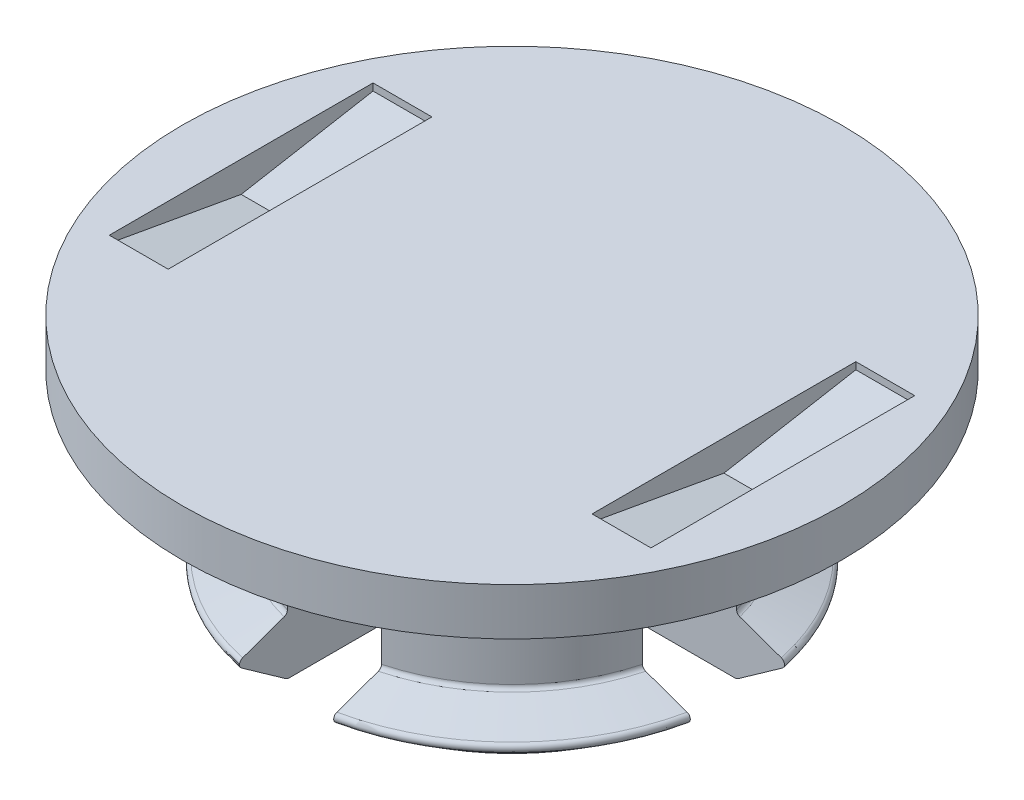
from build123d import *

# Parameters (mm, degrees)
SZKIC1_R                    = 7
DODANIE_WYCI_GNI_CIE1_DEPTH = 1
SZKIC2_R                    = 3.9
DODANIE_WYCI_GNI_CIE2_DEPTH = 4.3
ZAOKR_GLENIE1_R             = 0.1
WYTNIJ_WYCI_GNI_CIE1_DEPTH  = 4.3
SZKIC8_W                    = 1.25
SZKIC8_H                    = 5.6
WYTNIJ_WYCI_GNI_CIE2_DEPTH  = 0.65
DODANIE_WYCI_GNI_CIE3_DEPTH = 12


with BuildPart() as part:
    # Szkic1 → Dodanie-wyciągnięcie1 (new body)
    with BuildSketch(Plane(origin=(0, 0, 0), x_dir=(1, 0, 0), z_dir=(0, 1, 0))):
        Circle(SZKIC1_R)
    extrude(amount=DODANIE_WYCI_GNI_CIE1_DEPTH)

    # Szkic2 → Dodanie-wyciągnięcie2 (add)
    with BuildSketch(Plane(origin=(0, 0, 0), x_dir=(-1, 0, 0), z_dir=(0, -1, 0))):
        Circle(SZKIC2_R)
    extrude(amount=DODANIE_WYCI_GNI_CIE2_DEPTH)

    # Szkic3 → Obrót1 (revolve)
    with BuildSketch(Plane(origin=(0, 0, 0), x_dir=(0, 0, -1), z_dir=(1, 0, 0))):
        Polygon((3.9, -4.3), (5, -3.500367258), (3.9, -3.1), align=None)
    revolve(axis=Axis((0, -4.3, 0), (0, 1, 0)))

    # Zaokrąglenie1
    zaokr_glenie1_edges = [part.edges().sort_by_distance(p)[0] for p in [
        (0, -3.500367258, 5),
        (2.757716447, -3.1, 2.757716447),
        (0, -4.3, 3.9),
    ]]
    fillet(zaokr_glenie1_edges, radius=ZAOKR_GLENIE1_R)

    # Szkic5 → Wytnij-wyciągnięcie1 (cut)
    with BuildSketch(Plane(origin=(0, -4.3, 0), x_dir=(-1, 0, 0), z_dir=(0, -1, 0))):
        with BuildLine():
            Line((-7.794060286, -1), (-1, -1))
            Line((-1, -1), (-1, -7.794060286))
            ThreePointArc((-1, -7.794060286), (0, -7.857949844), (1, -7.794060286))
            Line((1, -7.794060286), (1, -1))
            Line((1, -1), (7.794060286, -1))
            ThreePointArc((7.794060286, -1), (7.857949844, 0), (7.794060286, 1))
            Line((7.794060286, 1), (1, 1))
            Line((1, 1), (1, 7.794060286))
            ThreePointArc((1, 7.794060286), (0, 7.857949844), (-1, 7.794060286))
            Line((-1, 7.794060286), (-1, 1))
            Line((-1, 1), (-7.794060286, 1))
            ThreePointArc((-7.794060286, 1), (-7.857949844, 0), (-7.794060286, -1))
        make_face()
    extrude(amount=-WYTNIJ_WYCI_GNI_CIE1_DEPTH, mode=Mode.SUBTRACT)

    # Szkic8 → Wytnij-wyciągnięcie2 (cut)
    with BuildSketch(Plane(origin=(0, 1, 0), x_dir=(1, 0, 0), z_dir=(0, 1, 0))):
        with Locations((5.125, 0)):
            Rectangle(SZKIC8_W, SZKIC8_H)
        with Locations((-5.125, 0)):
            Rectangle(SZKIC8_W, SZKIC8_H)
    extrude(amount=-WYTNIJ_WYCI_GNI_CIE2_DEPTH, mode=Mode.SUBTRACT)

    # Szkic10 → Dodanie-wyciągnięcie3 (add)
    with BuildSketch(Plane.ZY.offset(-5.75)):
        Polygon((0, 0.35), (-2.8, 0.85), (-2.8, 0.35), align=None)
        Polygon((2.8, 0.85), (0, 0.35), (2.8, 0.35), align=None)
    extrude(amount=DODANIE_WYCI_GNI_CIE3_DEPTH)


solid = part.part
